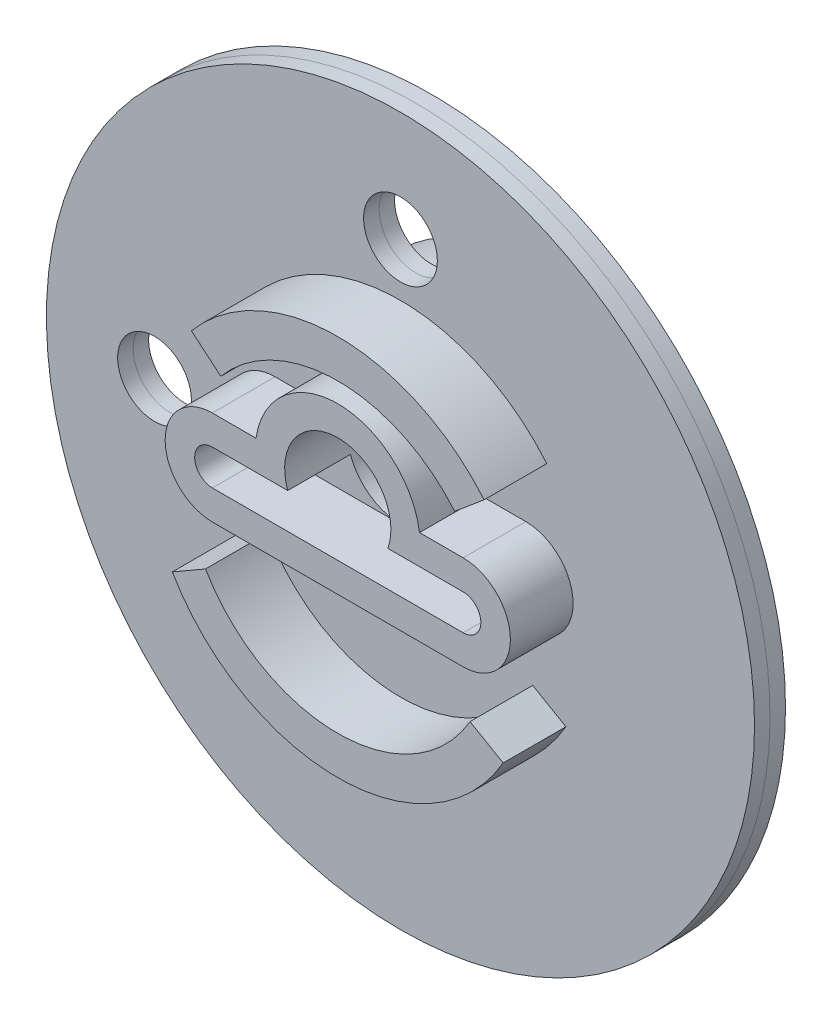
from build123d import *
from build123d.topology import SkipClean

# Parameters (mm, degrees)
SKETCH1_R               = 24
BOSS_EXTRUDE2_DEPTH     = 2.1
CUT_EXTRUDE1_DEPTH      = 35.006028877
CUT_EXTRUDE1_DEPTH_BACK = 35.006028877
SKETCH3_R               = 3.6
SKETCH6_R               = 4.85
SKETCH6_R_2             = 3.6
BOSS_EXTRUDE5_DEPTH     = 2.2
SKETCH7_R               = 11.25
SKETCH7_R_2             = 10
BOSS_EXTRUDE6_DEPTH     = 6
SPLIT1_SURFACE_1_BACK   = 69.364
SPLIT1_SURFACE_1_DEPTH  = 138.728
SPLIT1_SURFACE_2_BACK   = 69.364
SPLIT1_SURFACE_2_DEPTH  = 138.728
BOSS_EXTRUDE7_START     = 4.25
BOSS_EXTRUDE7_DEPTH     = 4.25
BOSS_EXTRUDE4_DEPTH     = 4.25
SKETCH10_R              = 2.5
CUT_EXTRUDE2_DEPTH      = 35.89426887


with BuildPart() as part:
    # Sketch1 → Boss-Extrude2 (new body)
    with BuildSketch(Plane.XY):
        Circle(SKETCH1_R)
    extrude(amount=BOSS_EXTRUDE2_DEPTH)

    # Sketch3 → Cut-Extrude1 (cut, two sides: drawn at the far end of the back side and taken through both)
    with BuildSketch(Plane.XY.offset(2.1).offset(-CUT_EXTRUDE1_DEPTH_BACK)):
        with Locations((0, 3.41)):
            Circle(SKETCH3_R)
    extrude(amount=CUT_EXTRUDE1_DEPTH + CUT_EXTRUDE1_DEPTH_BACK, mode=Mode.SUBTRACT)

    # Sketch6 → Boss-Extrude5 (add)
    with SkipClean():  # the faces are left unmerged after this step: merging them gives an invalid solid
        with BuildSketch(Plane(origin=(0, 0, 0), x_dir=(-1, 0, 0), z_dir=(0, 0, -1))):
            with Locations((0, 3.595)):
                Circle(SKETCH6_R)
            with Locations((0, 3.41)):
                Circle(SKETCH6_R_2, mode=Mode.SUBTRACT)
        extrude(amount=BOSS_EXTRUDE5_DEPTH)

    # Sketch7 → Boss-Extrude6 (add)
    with SkipClean():  # the faces are left unmerged after this step: merging them gives an invalid solid
        with BuildSketch(Plane(origin=(0, 0, 0), x_dir=(-1, 0, 0), z_dir=(0, 0, -1))):
            Circle(SKETCH7_R)
            Circle(SKETCH7_R_2, mode=Mode.SUBTRACT)
        extrude(amount=BOSS_EXTRUDE6_DEPTH)


with BuildPart() as body_2:
    # Split1: the piece behind the surface
    add(part.part)
    # Split1 surface: a surface, the sketch's curves swept straight by 138.728 mm
    with BuildLine(Plane(origin=(0, 0, 0), x_dir=(0, 0, -1), z_dir=(1, 0, 0)).offset(-SPLIT1_SURFACE_1_BACK), mode=Mode.PRIVATE) as split1_surface_1_path:
        Line((-1.05, 24), (-1.05, -24))
    split1_surface_1 = Shell.extrude(split1_surface_1_path.wire(), (1 * SPLIT1_SURFACE_1_DEPTH, 0 * SPLIT1_SURFACE_1_DEPTH, 0 * SPLIT1_SURFACE_1_DEPTH))
    split(bisect_by=split1_surface_1, keep=Keep.BOTTOM)

    # Sketch9 → Boss-Extrude7 (add)
    with BuildSketch(Plane.XY.offset(2.1).offset(BOSS_EXTRUDE7_START)):
        with BuildLine():
            Line((-8.5, -2.19), (8.5, -2.19))
            ThreePointArc((8.5, -2.19), (11.7, 1.01), (8.5, 4.21))
            Line((8.5, 4.21), (5.542562584, 4.21))
            ThreePointArc((5.542562584, 4.21), (0, 9.01), (-5.542562584, 4.21))
            Line((-5.542562584, 4.21), (-8.5, 4.21))
            ThreePointArc((-8.5, 4.21), (-11.7, 1.01), (-8.5, -2.19))
        make_face()
        with BuildLine():
            Line((-8.5, -0.19), (8.5, -0.19))
            ThreePointArc((8.5, -0.19), (9.7, 1.01), (8.5, 2.21))
            Line((8.5, 2.21), (3.39411255, 2.21))
            ThreePointArc((3.39411255, 2.21), (0, 7.01), (-3.39411255, 2.21))
            Line((-3.39411255, 2.21), (-8.5, 2.21))
            ThreePointArc((-8.5, 2.21), (-9.7, 1.01), (-8.5, -0.19))
        make_face(mode=Mode.SUBTRACT)
    extrude(amount=-BOSS_EXTRUDE7_DEPTH)

    # Sketch5 → Boss-Extrude4 (add)
    with BuildSketch(Plane.XY.offset(2.1)):
        with BuildLine():
            Line((7.928559986, 6.65285176), (9.920275538, 8.324099545))
            ThreePointArc((9.920275538, 8.324099545), (0, 12.95), (-9.920275538, 8.324099545))
            Line((-9.920275538, 8.324099545), (-7.928559986, 6.65285176))
            ThreePointArc((-7.928559986, 6.65285176), (0, 10.35), (7.928559986, 6.65285176))
        make_face()
        with BuildLine():
            Line((-8.963362929, -5.175), (-11.215028979, -6.475))
            ThreePointArc((-11.215028979, -6.475), (0, -12.95), (11.215028979, -6.475))
            Line((11.215028979, -6.475), (8.963362929, -5.175))
            ThreePointArc((8.963362929, -5.175), (0, -10.35), (-8.963362929, -5.175))
        make_face()
    extrude(amount=BOSS_EXTRUDE4_DEPTH)


with BuildPart() as part_1:
    add(part.part)

    # Split1: split by a surface, the side it looks to stays
    # Split1 surface: a surface, the sketch's curves swept straight by 138.728 mm
    with BuildLine(Plane(origin=(0, 0, 0), x_dir=(0, 0, -1), z_dir=(1, 0, 0)).offset(-SPLIT1_SURFACE_2_BACK), mode=Mode.PRIVATE) as split1_surface_2_path:
        Line((-1.05, 24), (-1.05, -24))
    split1_surface_2 = Shell.extrude(split1_surface_2_path.wire(), (1 * SPLIT1_SURFACE_2_DEPTH, 0 * SPLIT1_SURFACE_2_DEPTH, 0 * SPLIT1_SURFACE_2_DEPTH))
    split(bisect_by=split1_surface_2, keep=Keep.TOP)


with BuildPart() as cut_extrude2_tool:
    # Sketch10 → Cut-Extrude2 (new, through all)
    with SkipClean():  # the faces are left unmerged after this step: merging them gives an invalid solid
        with BuildSketch(Plane.XY.offset(2.1)):
            with Locations((0, 16.527610664)):
                Circle(SKETCH10_R)
            with Locations((-16.670494114, 0)):
                Circle(SKETCH10_R)
        extrude(amount=-CUT_EXTRUDE2_DEPTH)


with BuildPart() as part_2:
    with SkipClean():  # the faces are left unmerged after this step: merging them gives an invalid solid
        add(part_1.part)

        # Cut-Extrude2: cut by cut_extrude2_tool
        add(cut_extrude2_tool.part, mode=Mode.SUBTRACT)


with BuildPart() as body_2_1:
    with SkipClean():  # the faces are left unmerged after this step: merging them gives an invalid solid
        add(body_2.part)

        # Cut-Extrude2: cut by cut_extrude2_tool
        add(cut_extrude2_tool.part, mode=Mode.SUBTRACT)


solid = Compound([part_2.part, body_2_1.part])
